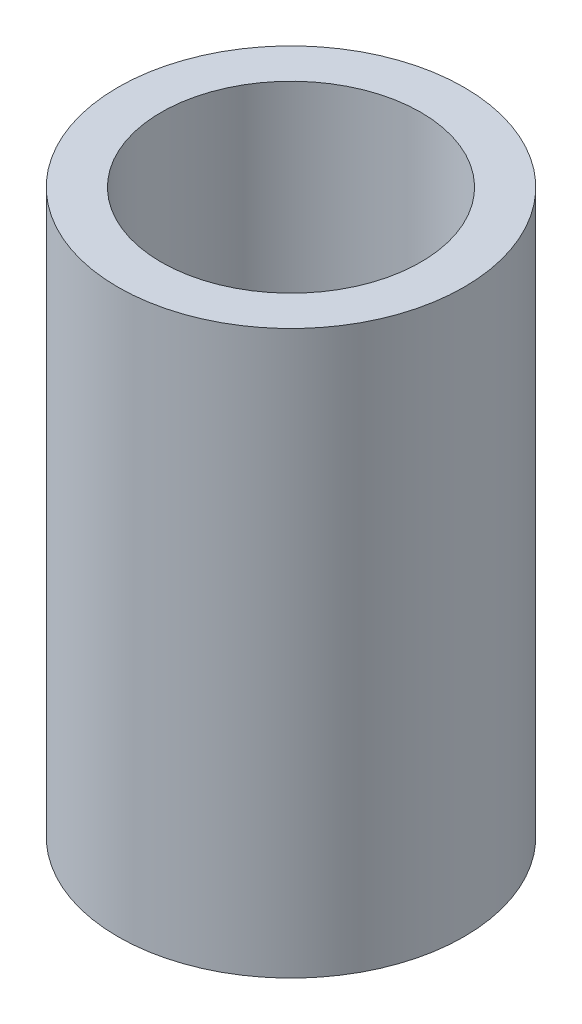
from build123d import *

# Parameters (mm, degrees)
SKETCH1_R           = 12.7
SKETCH1_R_2         = 9.525
BOSS_EXTRUDE2_DEPTH = 41.275


with BuildPart() as part:
    # Sketch1 → Boss-Extrude2 (new body)
    with BuildSketch(Plane(origin=(0, 0, 0), x_dir=(1, 0, 0), z_dir=(0, 1, 0))):
        Circle(SKETCH1_R)
        Circle(SKETCH1_R_2, mode=Mode.SUBTRACT)
    extrude(amount=BOSS_EXTRUDE2_DEPTH)


solid = part.part
